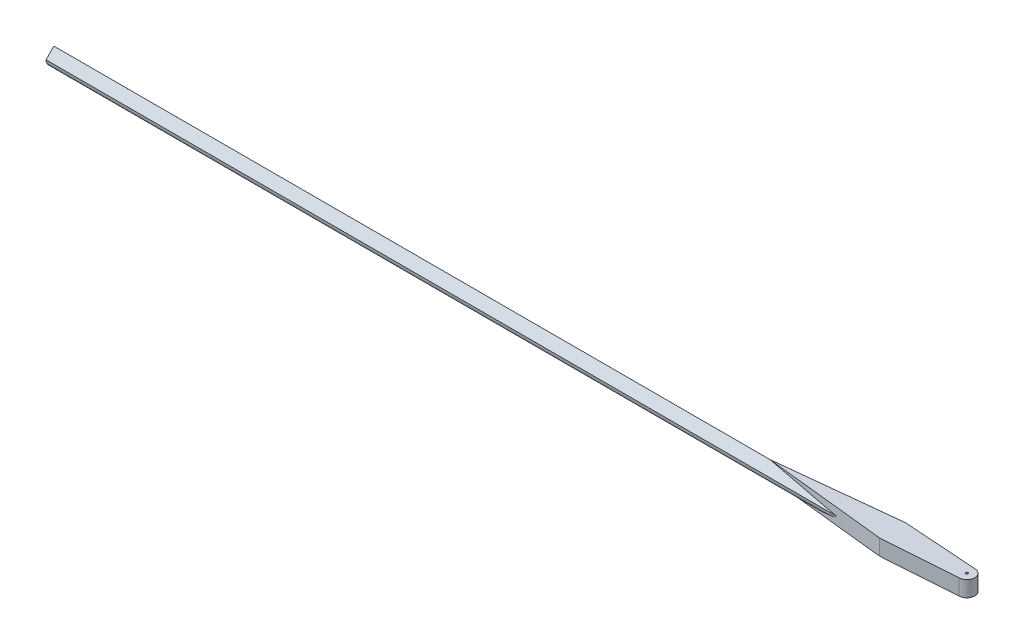
from build123d import *

# Parameters (mm, degrees)
SKETCH1_R           = 1.5
BOSS_EXTRUDE1_DEPTH = 10
CHAMFER1_SIZE       = 10
FILLET1_R           = 10


with BuildPart() as part:
    # Sketch1 → Boss-Extrude1 (new, symmetric)
    with BuildSketch(Plane(origin=(0, 0, 0), x_dir=(1, 0, 0), z_dir=(0, 1, 0))):
        with BuildLine():
            Line((500, 10.00169637), (561.410175266, 16.553276436))
            Line((561.410175266, 16.553276436), (655.434048607, 10.00169637))
            ThreePointArc((655.434048607, 10.00169637), (665.435744977, 0), (655.434048607, -10.00169637))
            Line((655.434048607, -10.00169637), (561.410175266, -16.553276436))
            Line((561.410175266, -16.553276436), (500, -10.00169637))
            Line((500, -10.00169637), (-500, -10.00169637))
            Line((-500, -10.00169637), (-500, 10.00169637))
            Line((-500, 10.00169637), (500, 10.00169637))
        make_face()
        with Locations(Location((655.434048607, 0, 0), (0, 0, 270))):
            Circle(SKETCH1_R, mode=Mode.SUBTRACT)
    extrude(amount=BOSS_EXTRUDE1_DEPTH, both=True)

    # Chamfer1
    chamfer1_edges = [part.edges().sort_by_distance(p)[0] for p in [
        (0, 10, -10.00169637),
        (0, 10, 10.00169637),
    ]]
    chamfer(chamfer1_edges, length=CHAMFER1_SIZE)

    # Fillet1
    fillet1_edges = [part.edges().sort_by_distance(p)[0] for p in [
        (0, -10, 10.00169637),
        (0, -10, -10.00169637),
    ]]
    fillet(fillet1_edges, radius=FILLET1_R - 0.0001)  # a hair under: the kernel refuses the full size


solid = part.part
